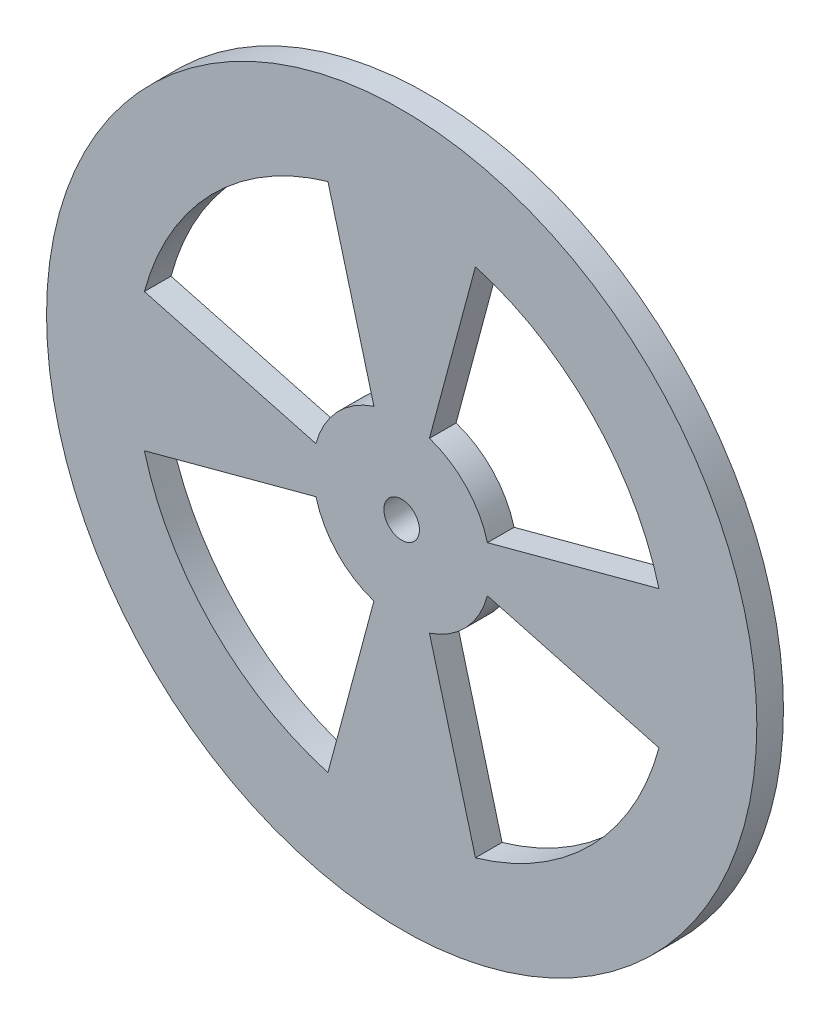
from build123d import *

# Parameters (mm, degrees)
ESQUISSE1_R        = 40
ESQUISSE1_R_2      = 2
BOSS_EXTRU_1_DEPTH = 3


with BuildPart() as part:
    # Esquisse1 → Boss.-Extru.1 (new body)
    with BuildSketch(Plane.XY):
        Circle(ESQUISSE1_R)
        with BuildLine():
            Line((3.127715259, 9.498283911), (8.306831977, 28.827010641))
            ThreePointArc((8.306831977, 28.827010641), (21.411260183, 21.013280024), (28.977774789, 7.764571353))
            Line((28.977774789, 7.764571353), (9.659258263, 2.588190451))
            ThreePointArc((9.659258263, 2.588190451), (7.267325565, 6.869205131), (3.127715259, 9.498283911))
        make_face(mode=Mode.SUBTRACT)
        with BuildLine():
            Line((-8.306831977, 28.827010641), (-3.127715259, 9.498283911))
            ThreePointArc((-3.127715259, 9.498283911), (-7.267325565, 6.869205131), (-9.659258263, 2.588190451))
            Line((-9.659258263, 2.588190451), (-28.977774789, 7.764571353))
            ThreePointArc((-28.977774789, 7.764571353), (-21.411260183, 21.013280024), (-8.306831977, 28.827010641))
        make_face(mode=Mode.SUBTRACT)
        with BuildLine():
            ThreePointArc((-8.306831977, -28.827010641), (-21.411260183, -21.013280024), (-28.977774789, -7.764571353))
            Line((-28.977774789, -7.764571353), (-9.659258263, -2.588190451))
            ThreePointArc((-9.659258263, -2.588190451), (-7.267325565, -6.869205131), (-3.127715259, -9.498283911))
            Line((-3.127715259, -9.498283911), (-8.306831977, -28.827010641))
        make_face(mode=Mode.SUBTRACT)
        with BuildLine():
            ThreePointArc((28.977774789, -7.764571353), (21.411260183, -21.013280024), (8.306831977, -28.827010641))
            Line((8.306831977, -28.827010641), (3.127715259, -9.498283911))
            ThreePointArc((3.127715259, -9.498283911), (7.267325565, -6.869205131), (9.659258263, -2.588190451))
            Line((9.659258263, -2.588190451), (28.977774789, -7.764571353))
        make_face(mode=Mode.SUBTRACT)
        Circle(ESQUISSE1_R_2, mode=Mode.SUBTRACT)
    extrude(amount=BOSS_EXTRU_1_DEPTH)


solid = part.part
